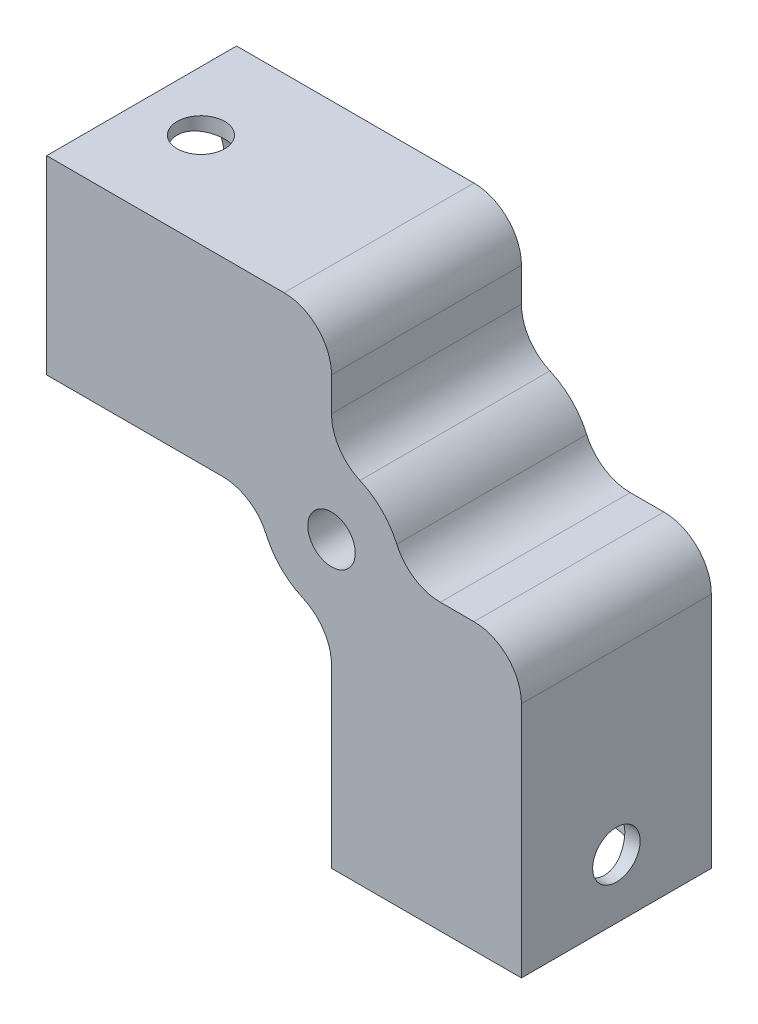
from build123d import *
from build123d.topology import SkipClean

# Parameters (mm, degrees)
SKETCH1_R           = 3.5
SKETCH1_R_2         = 1
BOSS_EXTRUDE1_DEPTH = 8
SKETCH5_R           = 3.5
CUT_EXTRUDE1_DEPTH  = 8
SKETCH6_R           = 3.5
CUT_EXTRUDE2_DEPTH  = 8
BOSS_EXTRUDE2_START = -0.5
SKETCH2_R           = 3.5
BOSS_EXTRUDE2_DEPTH = 0.5
SKETCH4_R           = 3.5
BOSS_EXTRUDE3_DEPTH = 0.5
SKETCH7_R           = 1
CUT_EXTRUDE3_DEPTH  = 8
SKETCH8_R           = 1
CUT_EXTRUDE4_DEPTH  = 8
BOSS_EXTRUDE4_START = 1
SKETCH9_R           = 2.5
SKETCH9_R_2         = 1
BOSS_EXTRUDE4_DEPTH = 1
BOSS_EXTRUDE5_START = 1
SKETCH10_R          = 2.5
SKETCH10_R_2        = 1
BOSS_EXTRUDE5_DEPTH = 1


with BuildPart() as part:
    # Sketch1 → Boss-Extrude1 (new body)
    with BuildSketch(Plane.XY):
        with BuildLine():
            Line((0, 0), (0, 8))
            Line((0, 8), (10, 8))
            ThreePointArc((10, 8), (11.414213562, 7.414213562), (12, 6))
            Line((12, 6), (12, 4.582575695))
            ThreePointArc((12, 4.582575695), (12.326679947, 3.48713058), (13.2, 2.749545417))
            ThreePointArc((13.2, 2.749545417), (14.121320344, 2.121320344), (14.749545417, 1.2))
            ThreePointArc((14.749545417, 1.2), (15.48713058, 0.326679947), (16.582575695, 0))
            Line((16.582575695, 0), (18, 0))
            ThreePointArc((18, 0), (19.414213562, -0.585786438), (20, -2))
            Line((20, -2), (20, -12))
            Line((20, -12), (12, -12))
            Line((12, -12), (12, -4.582575695))
            ThreePointArc((12, -4.582575695), (11.673320053, -3.48713058), (10.8, -2.749545417))
            ThreePointArc((10.8, -2.749545417), (9.878679656, -2.121320344), (9.250454583, -1.2))
            ThreePointArc((9.250454583, -1.2), (8.51286942, -0.326679947), (7.417424305, 0))
            Line((7.417424305, 0), (0, 0))
        make_face()
        with Locations((8, 4)):
            Circle(SKETCH1_R, mode=Mode.SUBTRACT)
        with Locations((16, -4)):
            Circle(SKETCH1_R, mode=Mode.SUBTRACT)
        with Locations((12, 0)):
            Circle(SKETCH1_R_2, mode=Mode.SUBTRACT)
    extrude(amount=BOSS_EXTRUDE1_DEPTH)

    # Sketch5 → Cut-Extrude1 (cut)
    with BuildSketch(Plane.ZY):
        with Locations((4, 4)):
            Circle(SKETCH5_R)
    extrude(amount=-CUT_EXTRUDE1_DEPTH, mode=Mode.SUBTRACT)

    # Sketch6 → Cut-Extrude2 (cut)
    with BuildSketch(Plane.XZ.offset(12)):
        with Locations((16, 4)):
            Circle(SKETCH6_R)
    extrude(amount=-CUT_EXTRUDE2_DEPTH, mode=Mode.SUBTRACT)

    # Sketch2 → Boss-Extrude2 (add)
    with BuildSketch(Plane.XY.offset(8).offset(BOSS_EXTRUDE2_START)):
        with Locations((8, 4)):
            Circle(SKETCH2_R)
        with Locations((16, -4)):
            Circle(SKETCH2_R)
    extrude(amount=BOSS_EXTRUDE2_DEPTH)

    # Sketch4 → Boss-Extrude3 (add)
    with SkipClean():  # the faces are left unmerged after this step: merging them gives an invalid solid
        with BuildSketch(Plane(origin=(0, 0, 0), x_dir=(-1, 0, 0), z_dir=(0, 0, -1))):
            with Locations((-8, 4)):
                Circle(SKETCH4_R)
            with Locations((-16, -4)):
                Circle(SKETCH4_R)
        extrude(amount=-BOSS_EXTRUDE3_DEPTH)

    # Sketch7 → Cut-Extrude3 (cut)
    with SkipClean():  # the faces are left unmerged after this step: merging them gives an invalid solid
        with BuildSketch(Plane.XZ):
            with Locations((2.5, 4)):
                Circle(SKETCH7_R)
        extrude(amount=-CUT_EXTRUDE3_DEPTH, mode=Mode.SUBTRACT)

    # Sketch8 → Cut-Extrude4 (cut)
    with SkipClean():  # the faces are left unmerged after this step: merging them gives an invalid solid
        with BuildSketch(Plane.ZY.offset(-12)):
            with Locations((4, -9.5)):
                Circle(SKETCH8_R)
        extrude(amount=-CUT_EXTRUDE4_DEPTH, mode=Mode.SUBTRACT)

    # Sketch9 → Boss-Extrude4 (add)
    with SkipClean():  # the faces are left unmerged after this step: merging them gives an invalid solid
        with BuildSketch(Plane.XZ.offset(BOSS_EXTRUDE4_START)):
            with Locations((2.5, 4)):
                Circle(SKETCH9_R)
            with Locations((2.5, 4)):
                Circle(SKETCH9_R_2, mode=Mode.SUBTRACT)
        extrude(amount=-BOSS_EXTRUDE4_DEPTH)

    # Sketch10 → Boss-Extrude5 (add)
    with SkipClean():  # the faces are left unmerged after this step: merging them gives an invalid solid
        with BuildSketch(Plane.ZY.offset(-12).offset(BOSS_EXTRUDE5_START)):
            with Locations((4, -9.5)):
                Circle(SKETCH10_R)
            with Locations((4, -9.5)):
                Circle(SKETCH10_R_2, mode=Mode.SUBTRACT)
        extrude(amount=-BOSS_EXTRUDE5_DEPTH)


solid = part.part
